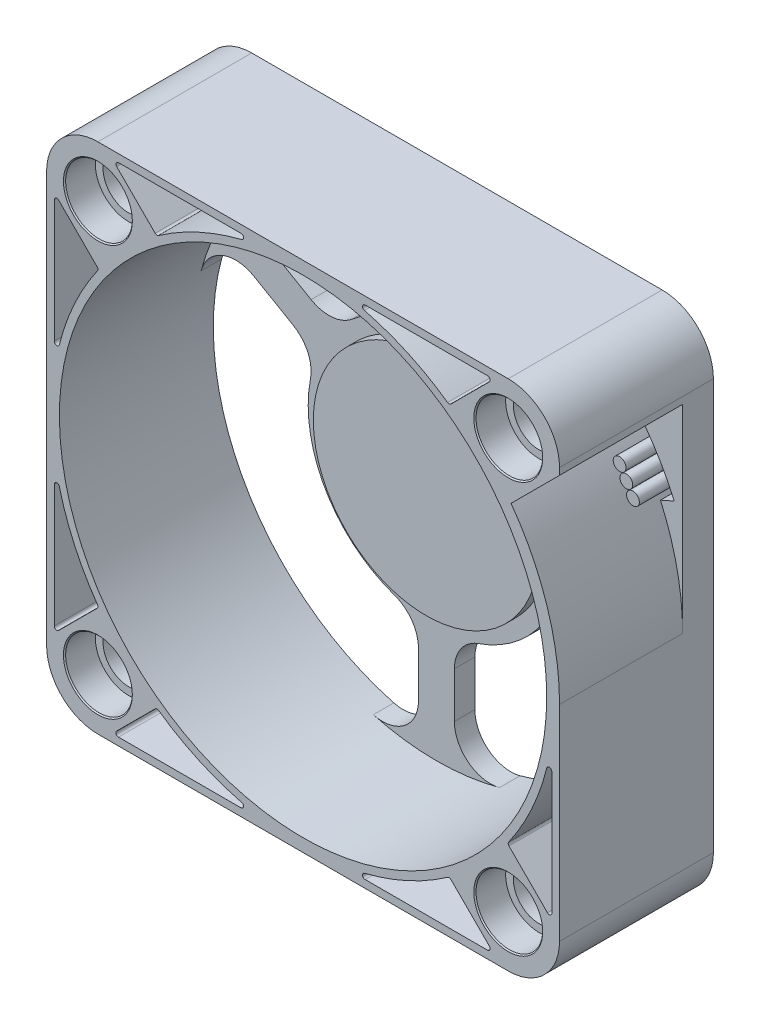
from build123d import *

# Parameters (mm, degrees)
SKETCH_1_R                 = 23.75
SKETCH_1_R_2               = 12.5
EXTRUDE_1_DEPTH            = 15
CUT_EXTRUDE_1_OUTLINE_W    = 23.75
CUT_EXTRUDE_1_OUTLINE_H    = 13
HOLE_WIZARD_M51_AT_2_COUNT = 2
HOLE_WIZARD_M51_AT_2_PITCH = 40
HOLE_WIZARD_M51_AT_3_COUNT = 2
HOLE_WIZARD_M51_AT_3_PITCH = 56.568542495
HOLE_WIZARD_M51_AT_4_COUNT = 2
HOLE_WIZARD_M51_AT_4_PITCH = 40
CUT_EXTRUDE_2_DEPTH        = 13
SKETCH_7_W                 = 1
SKETCH_7_H                 = 11
CUT_EXTRUDE_3_DEPTH        = 12
CUT_EXTRUDE_4_DEPTH        = 38.336309405
CUT_EXTRUDE_5_DEPTH        = 1.5
SKETCH_12_R                = 0.625
PATTERN_LINEAR_1_COUNT     = 3
PATTERN_LINEAR_1_PITCH     = 1.3


# Read off the part's stored shape, not the designer's step: Вырез-Вытянуть1
with BuildPart() as part:
    # Эскиз1 → Бобышка-Вытянуть1 (new body)
    # profile 1 of 17: a face of its own
    with BuildSketch(Plane.XY):
        with BuildLine():
            ThreePointArc((-25, 20), (-23.535533906, 23.535533906), (-20, 25))
            Line((-20, 25), (20, 25))
            ThreePointArc((20, 25), (23.535533906, 23.535533906), (25, 20))
            Line((25, 20), (25, -20))
            ThreePointArc((25, -20), (23.535533906, -23.535533906), (20, -25))
            Line((20, -25), (-20, -25))
            ThreePointArc((-20, -25), (-23.535533906, -23.535533906), (-25, -20))
            Line((-25, -20), (-25, 20))
        make_face()
        Circle(SKETCH_1_R, mode=Mode.SUBTRACT)
    # profile 2 of 17: a face of its own
    with BuildSketch(Plane.XY):
        with BuildLine():
            ThreePointArc((-16.786130187, 16.801438431), (-18.292852528, 15.147080458), (-19.637191497, 13.358263739))
            Line((-19.637191497, 13.358263739), (-16.062384686, 11.294348064))
            ThreePointArc((-16.062384686, 11.294348064), (-17.782545718, 13.869386093), (-16.786130187, 16.801438431))
        make_face()
    # profile 3 of 17: a face of its own
    with BuildSketch(Plane.XY):
        with BuildLine():
            ThreePointArc((-21.387191497, 10.327174826), (-22.264182733, 8.268534768), (-22.943537595, 6.136495958))
            ThreePointArc((-22.943537595, 6.136495958), (-20.90251355, 8.46544329), (-17.812384686, 8.263259151))
            Line((-17.812384686, 8.263259151), (-21.387191497, 10.327174826))
        make_face()
    # profile 4 of 17: a face of its own
    with BuildSketch(Plane.XY):
        with BuildLine():
            Line((-13.964236991, 6.041530043), (-11.593704446, 4.672902441))
            ThreePointArc((-11.593704446, 4.672902441), (-10.825317547, 6.25), (-9.843704446, 7.703991354))
            Line((-9.843704446, 7.703991354), (-12.214236991, 9.072618957))
            Line((-12.214236991, 9.072618957), (-16.062384686, 11.294348064))
            Line((-16.062384686, 11.294348064), (-19.637191497, 13.358263739))
            ThreePointArc((-19.637191497, 13.358263739), (-20.56810334, 11.875), (-21.387191497, 10.327174826))
            Line((-21.387191497, 10.327174826), (-17.812384686, 8.263259151))
            Line((-17.812384686, 8.263259151), (-13.964236991, 6.041530043))
        make_face()
    # profile 5 of 17: a face of its own
    with BuildSketch(Plane.XY):
        with BuildLine():
            Line((14.705906994, 12.531911246), (18.593533985, 14.776433736))
            ThreePointArc((18.593533985, 14.776433736), (16.983553384, 16.60184973), (15.195199561, 18.252901421))
            ThreePointArc((15.195199561, 18.252901421), (16.443176118, 15.264748492), (14.705906994, 12.531911246))
        make_face()
    # profile 6 of 17: a face of its own
    with BuildSketch(Plane.XY):
        with BuildLine():
            ThreePointArc((6.999949839, 10.356191493), (7.849140534, 9.728360236), (8.642304845, 9.031088913))
            Line((8.642304845, 9.031088913), (10.709935794, 10.224836198))
            ThreePointArc((10.709935794, 10.224836198), (8.836092834, 9.758116809), (6.999949839, 10.356191493))
        make_face()
    # profile 7 of 17: a face of its own
    with BuildSketch(Plane.XY):
        with BuildLine():
            Line((-12.214236991, 9.072618957), (-9.843704446, 7.703991354))
            ThreePointArc((-9.843704446, 7.703991354), (-9.051933396, 8.620469929), (-8.175185149, 9.456021773))
            ThreePointArc((-8.175185149, 9.456021773), (-10.133489879, 8.61937058), (-12.214236991, 9.072618957))
        make_face()
    # profile 8 of 17: a face of its own
    with BuildSketch(Plane.XY):
        with BuildLine():
            ThreePointArc((-13.964236991, 6.041530043), (-12.531338827, 4.466174374), (-12.276747649, 2.351907133))
            ThreePointArc((-12.276747649, 2.351907133), (-11.991512649, 3.52896931), (-11.593704446, 4.672902441))
            Line((-11.593704446, 4.672902441), (-13.964236991, 6.041530043))
        make_face()
    # profile 9 of 17: a face of its own
    with BuildSketch(Plane.XY):
        Circle(SKETCH_1_R_2)
    # profile 10 of 17: a face of its own
    with BuildSketch(Plane.XY):
        with BuildLine():
            ThreePointArc((18.205906994, 6.46973342), (21.441248035, 6.607833991), (23.405076104, 4.032978125))
            ThreePointArc((23.405076104, 4.032978125), (22.869400308, 6.407263812), (22.093533985, 8.714255909))
            Line((22.093533985, 8.714255909), (18.205906994, 6.46973342))
        make_face()
    # profile 11 of 17: a face of its own
    with BuildSketch(Plane.XY):
        with BuildLine():
            ThreePointArc((12.142304845, 2.968911087), (12.349577368, 1.933374982), (12.468699839, 0.884038639))
            ThreePointArc((12.468699839, 0.884038639), (12.868823467, 2.77322246), (14.209935794, 4.162658372))
            Line((14.209935794, 4.162658372), (12.142304845, 2.968911087))
        make_face()
    # profile 12 of 17: a face of its own
    with BuildSketch(Plane.XY):
        with BuildLine():
            ThreePointArc((8.642304845, 9.031088913), (10.825317547, 6.25), (12.142304845, 2.968911087))
            Line((12.142304845, 2.968911087), (14.209935794, 4.162658372))
            Line((14.209935794, 4.162658372), (18.205906994, 6.46973342))
            Line((18.205906994, 6.46973342), (22.093533985, 8.714255909))
            ThreePointArc((22.093533985, 8.714255909), (20.56810334, 11.875), (18.593533985, 14.776433736))
            Line((18.593533985, 14.776433736), (14.705906994, 12.531911246))
            Line((14.705906994, 12.531911246), (10.709935794, 10.224836198))
            Line((10.709935794, 10.224836198), (8.642304845, 9.031088913))
        make_face()
    # profile 13 of 17: a face of its own
    with BuildSketch(Plane.XY):
        with BuildLine():
            Line((1.75, -15.114149), (1.75, -12.376893794))
            ThreePointArc((1.75, -12.376893794), (0, -12.5), (-1.75, -12.376893794))
            Line((-1.75, -12.376893794), (-1.75, -15.114149))
            Line((-1.75, -15.114149), (-1.75, -19.557607216))
            Line((-1.75, -19.557607216), (-1.75, -23.685438565))
            ThreePointArc((-1.75, -23.685438565), (0, -23.75), (1.75, -23.685438565))
            Line((1.75, -23.685438565), (1.75, -19.557607216))
            Line((1.75, -19.557607216), (1.75, -15.114149))
        make_face()
    # profile 14 of 17: a face of its own
    with BuildSketch(Plane.XY):
        with BuildLine():
            ThreePointArc((4.1015625, -11.807928906), (2.939579253, -12.149439239), (1.75, -12.376893794))
            Line((1.75, -12.376893794), (1.75, -15.114149))
            ThreePointArc((1.75, -15.114149), (2.397848948, -13.085544954), (4.1015625, -11.807928906))
        make_face()
    # profile 15 of 17: a face of its own
    with BuildSketch(Plane.XY):
        with BuildLine():
            Line((-1.75, -15.114149), (-1.75, -12.376893794))
            ThreePointArc((-1.75, -12.376893794), (-2.939579253, -12.149439239), (-4.1015625, -11.807928906))
            ThreePointArc((-4.1015625, -11.807928906), (-2.397848948, -13.085544954), (-1.75, -15.114149))
        make_face()
    # profile 16 of 17: a face of its own
    with BuildSketch(Plane.XY):
        with BuildLine():
            Line((-1.75, -23.685438565), (-1.75, -19.557607216))
            ThreePointArc((-1.75, -19.557607216), (-3.119967832, -22.334829382), (-6.157407407, -22.937934389))
            ThreePointArc((-6.157407407, -22.937934389), (-3.971330205, -23.415615226), (-1.75, -23.685438565))
        make_face()
    # profile 17 of 17: a face of its own
    with BuildSketch(Plane.XY):
        with BuildLine():
            ThreePointArc((6.157407407, -22.937934389), (3.119967832, -22.334829382), (1.75, -19.557607216))
            Line((1.75, -19.557607216), (1.75, -23.685438565))
            ThreePointArc((1.75, -23.685438565), (3.971330205, -23.415615226), (6.157407407, -22.937934389))
        make_face()
    extrude(amount=EXTRUDE_1_DEPTH)

    # Вырез-Вытянуть1 outline → Вырез-Вытянуть1 (revolve, cut)
    with BuildSketch(Plane.XZ):
        with Locations((11.875, 8.5)):
            Rectangle(CUT_EXTRUDE_1_OUTLINE_W, CUT_EXTRUDE_1_OUTLINE_H)
    revolve(axis=Axis((0, 0, 0), (0, 0, 1)), mode=Mode.SUBTRACT)

    # Эскиз5 → Цековка для  болта с шестигранной головкой M51 (revolve, cut)
    with BuildSketch(Plane(origin=(-20, 20, 15), x_dir=(0, -1, 0), z_dir=(1, 0, 0))):
        Polygon((0, 0), (0, 15), (2.5, 15), (2.5, 3), (3.25, 3), (3.25, 0.11), (3.36, 0), align=None)
    hole_wizard_m51 = revolve(axis=Axis((-20, 20, 21.35), (0, 0, -1)), mode=Mode.SUBTRACT)

    # Цековка для  болта с шестигранной головкой M51 at 2: Цековка для  болта с шестигранной головкой M51 ×2
    with Locations(*[(i * HOLE_WIZARD_M51_AT_2_PITCH, 0, 0) for i in range(1, HOLE_WIZARD_M51_AT_2_COUNT)]):
        add(hole_wizard_m51, mode=Mode.SUBTRACT)

    # Цековка для  болта с шестигранной головкой M51 at 3: Цековка для  болта с шестигранной головкой M51 ×2
    with Locations(*[Vector(0.7071067811865476, -0.7071067811865475, 0) * (i * HOLE_WIZARD_M51_AT_3_PITCH) for i in range(1, HOLE_WIZARD_M51_AT_3_COUNT)]):
        add(hole_wizard_m51, mode=Mode.SUBTRACT)

    # Цековка для  болта с шестигранной головкой M51 at 4: Цековка для  болта с шестигранной головкой M51 ×2
    with Locations(*[(0, -i * HOLE_WIZARD_M51_AT_4_PITCH, 0) for i in range(1, HOLE_WIZARD_M51_AT_4_COUNT)]):
        add(hole_wizard_m51, mode=Mode.SUBTRACT)

    # Эскиз6 → Вырез-Вытянуть2 (cut)
    with BuildSketch(Plane.XY.offset(15)):
        with BuildLine():
            ThreePointArc((14.091940518, 20.04163697), (10.209266144, 22.271526324), (5.985615601, 23.757575758))
            ThreePointArc((5.985615601, 23.757575758), (5.798594479, 24.030772873), (6.046693311, 24.25))
            Line((6.046693311, 24.25), (17.98959236, 24.25))
            ThreePointArc((17.98959236, 24.25), (18.220562243, 24.095670858), (18.166369055, 23.823223305))
            Line((18.166369055, 23.823223305), (14.412512525, 20.069366774))
            ThreePointArc((14.412512525, 20.069366774), (14.25728063, 19.997073557), (14.091940518, 20.04163697))
        make_face()
        with BuildLine():
            Line((-14.412512525, 20.069366774), (-18.166369055, 23.823223305))
            ThreePointArc((-18.166369055, 23.823223305), (-18.220562243, 24.095670858), (-17.98959236, 24.25))
            Line((-17.98959236, 24.25), (-6.046693311, 24.25))
            ThreePointArc((-6.046693311, 24.25), (-5.798594479, 24.030772873), (-5.985615601, 23.757575758))
            ThreePointArc((-5.985615601, 23.757575758), (-10.209266144, 22.271526324), (-14.091940518, 20.04163697))
            ThreePointArc((-14.091940518, 20.04163697), (-14.25728063, 19.997073557), (-14.412512525, 20.069366774))
        make_face()
        with BuildLine():
            ThreePointArc((-20.04163697, 14.091940518), (-22.271526324, 10.209266144), (-23.757575758, 5.985615601))
            ThreePointArc((-23.757575758, 5.985615601), (-24.030772873, 5.798594479), (-24.25, 6.046693311))
            Line((-24.25, 6.046693311), (-24.25, 17.98959236))
            ThreePointArc((-24.25, 17.98959236), (-24.095670858, 18.220562243), (-23.823223305, 18.166369055))
            Line((-23.823223305, 18.166369055), (-20.069366774, 14.412512525))
            ThreePointArc((-20.069366774, 14.412512525), (-19.997073557, 14.25728063), (-20.04163697, 14.091940518))
        make_face()
        with BuildLine():
            Line((-20.069366774, -14.412512525), (-23.823223305, -18.166369055))
            ThreePointArc((-23.823223305, -18.166369055), (-24.095670858, -18.220562243), (-24.25, -17.98959236))
            Line((-24.25, -17.98959236), (-24.25, -6.046693311))
            ThreePointArc((-24.25, -6.046693311), (-24.030772873, -5.798594479), (-23.757575758, -5.985615601))
            ThreePointArc((-23.757575758, -5.985615601), (-22.271526324, -10.209266144), (-20.04163697, -14.091940518))
            ThreePointArc((-20.04163697, -14.091940518), (-19.997073557, -14.25728063), (-20.069366774, -14.412512525))
        make_face()
        with BuildLine():
            ThreePointArc((-14.091940518, -20.04163697), (-10.209266144, -22.271526324), (-5.985615601, -23.757575758))
            ThreePointArc((-5.985615601, -23.757575758), (-5.798594479, -24.030772873), (-6.046693311, -24.25))
            Line((-6.046693311, -24.25), (-17.98959236, -24.25))
            ThreePointArc((-17.98959236, -24.25), (-18.220562243, -24.095670858), (-18.166369055, -23.823223305))
            Line((-18.166369055, -23.823223305), (-14.412512525, -20.069366774))
            ThreePointArc((-14.412512525, -20.069366774), (-14.25728063, -19.997073557), (-14.091940518, -20.04163697))
        make_face()
        with BuildLine():
            Line((14.412512525, -20.069366774), (18.166369055, -23.823223305))
            ThreePointArc((18.166369055, -23.823223305), (18.220562243, -24.095670858), (17.98959236, -24.25))
            Line((17.98959236, -24.25), (6.046693311, -24.25))
            ThreePointArc((6.046693311, -24.25), (5.798594479, -24.030772873), (5.985615601, -23.757575758))
            ThreePointArc((5.985615601, -23.757575758), (10.209266144, -22.271526324), (14.091940518, -20.04163697))
            ThreePointArc((14.091940518, -20.04163697), (14.25728063, -19.997073557), (14.412512525, -20.069366774))
        make_face()
        with BuildLine():
            ThreePointArc((20.04163697, -14.091940518), (22.271526324, -10.209266144), (23.757575758, -5.985615601))
            ThreePointArc((23.757575758, -5.985615601), (24.030772873, -5.798594479), (24.25, -6.046693311))
            Line((24.25, -6.046693311), (24.25, -17.98959236))
            ThreePointArc((24.25, -17.98959236), (24.095670858, -18.220562243), (23.823223305, -18.166369055))
            Line((23.823223305, -18.166369055), (20.069366774, -14.412512525))
            ThreePointArc((20.069366774, -14.412512525), (19.997073557, -14.25728063), (20.04163697, -14.091940518))
        make_face()
    extrude(amount=-CUT_EXTRUDE_2_DEPTH, mode=Mode.SUBTRACT)

    # Эскиз7 → Повернуть1 (revolve)
    with BuildSketch(Plane(origin=(0, 0, 0), x_dir=(0, 0, -1), z_dir=(1, 0, 0)), mode=Mode.PRIVATE) as revolve_1_sk:
        with Locations((-2.5, 5.5)):
            Rectangle(SKETCH_7_W, SKETCH_7_H)
    revolve(revolve_1_sk.sketch.rotate(Axis((0, 0, 0), (0, 0, 1)), 75.026113759), axis=Axis((0, 0, 0), (0, 0, 1)))

    # Эскиз8 → Вырез-Вытянуть3 (cut)
    with BuildSketch(Plane.XY.offset(15)):
        with BuildLine():
            Line((20.278355491, 14.621501242), (25, 19.343145751))
            Line((25, 19.343145751), (25, 0))
            ThreePointArc((25, 0), (23.790322479, 7.682483736), (20.278355491, 14.621501242))
        make_face()
    extrude(amount=-CUT_EXTRUDE_3_DEPTH, mode=Mode.SUBTRACT)

    # Эскиз9 → Вырез-Вытянуть4 (cut, through all)
    with BuildSketch(Plane.XY.offset(3)):
        with BuildLine():
            Line((20.278355491, 14.621501242), (21.339015663, 15.682161414))
            ThreePointArc((21.339015663, 15.682161414), (22.897700128, 13.303349388), (24.192294376, 10.77110342))
            Line((24.192294376, 10.77110342), (22.838636441, 10.168416077))
            ThreePointArc((22.838636441, 10.168416077), (21.67316867, 12.460889206), (20.278355491, 14.621501242))
        make_face()
    extrude(amount=-CUT_EXTRUDE_4_DEPTH, mode=Mode.SUBTRACT)

    # Эскиз10 → Вырез-Вытянуть5 (cut)
    with BuildSketch(Plane(origin=(0, 0, 0), x_dir=(-1, 0, 0), z_dir=(0, 0, -1))):
        Polygon((-21.516660498, 14.732050808), (-9.392304845, 7.732050808), (-11.392304845, 4.267949192), (-23.516660498, 11.267949192), align=None)
    extrude(amount=-CUT_EXTRUDE_5_DEPTH, mode=Mode.SUBTRACT)

    # По траектории1: sweep along a path in Эскиз11
    with BuildLine(Plane(origin=(0.65, -1.125833025, 0), x_dir=(0.86602540378444, 0.4999999999999977, 0), z_dir=(-0.4999999999999977, 0.86602540378444, 0))) as sweep_1_path:
        Line((12, -0.75), (24.7, -0.75))
        ThreePointArc((24.7, -0.75), (25.407106781, -1.042893219), (25.7, -1.75))
        Line((25.7, -1.75), (25.7, -5.75))
    # Эскиз12 → По траектории1 (sweep)
    with BuildSketch(Plane(origin=(10.392304845, 6, 0), x_dir=(0, 0, -1), z_dir=(0.8660254037844394, 0.4999999999999989, 0))):
        with Locations((-0.75, -1.3)):
            Circle(SKETCH_12_R)
    sweep_1 = sweep(path=sweep_1_path.line)

    # Линейный массив1: По траектории1 ×3
    with Locations(*[Vector(-0.49999999999999856, 0.8660254037844395, 0) * (i * PATTERN_LINEAR_1_PITCH) for i in range(1, PATTERN_LINEAR_1_COUNT)]):
        add(sweep_1)


solid = part.part
